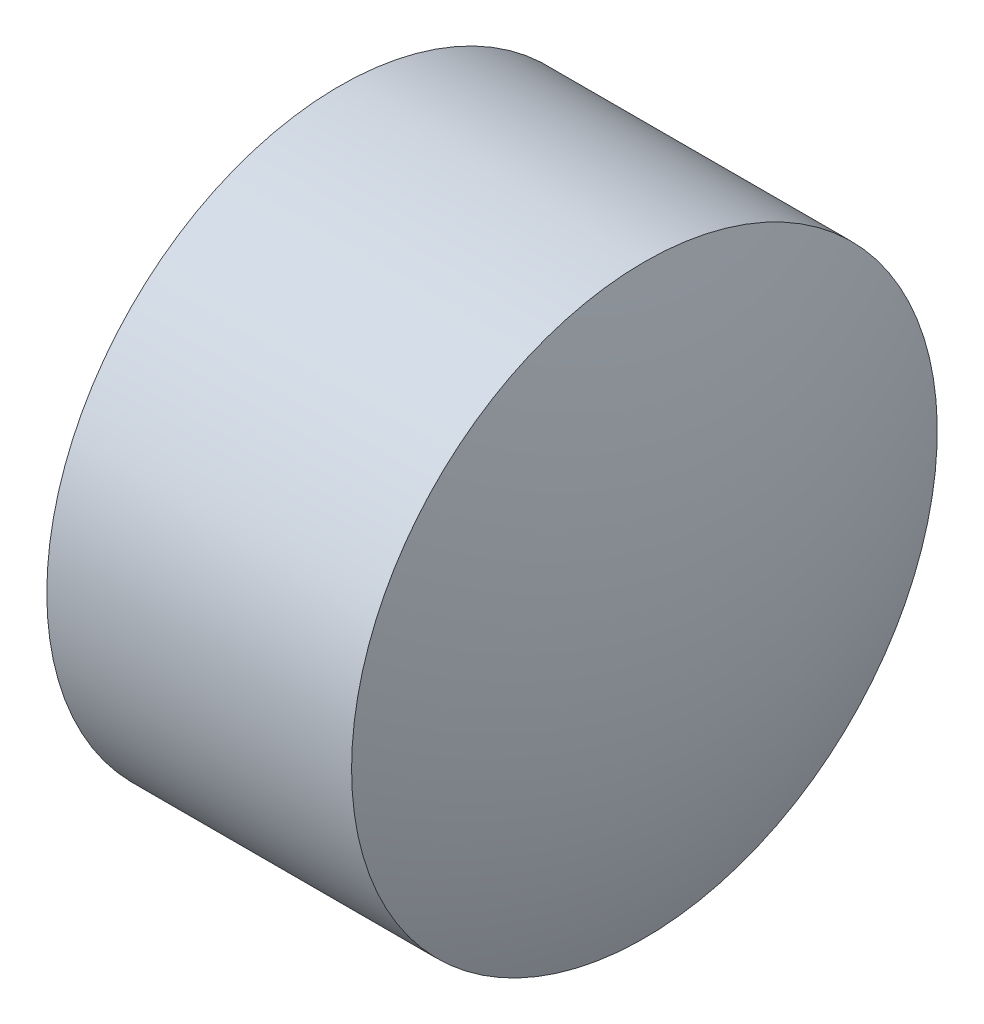
from build123d import *

# Parameters (mm, degrees)
HEXAGONSOCKET_DEPTH = 1.2


with BuildPart() as part:
    # BodySke → BaseBody (revolve)
    with BuildSketch(Plane.XY):
        with BuildLine():
            Line((0, 1.5), (0, 0))
            Line((0, 0), (2, 0))
            ThreePointArc((2, 0), (1.930171789, 0.76268014), (1.723009049, 1.5))
            Line((1.723009049, 1.5), (0, 1.5))
        make_face()
    revolve(axis=Axis((0, 0, 0), (1, 0, 0)))

    # HeadChamferSke → HeadChamfer (revolve, cut)
    with BuildSketch(Plane.XY):
        Polygon((0, 1.5), (0, 1.2195), (0.161946751, 1.5), align=None)
    revolve(axis=Axis((0, 0, 0), (1, 0, 0)), mode=Mode.SUBTRACT)

    # HexagonSocketSke → HexagonSocket (cut)
    with BuildSketch(Plane.ZY):
        Polygon((0, 0.866025404), (-0.75, 0.433012702), (-0.75, -0.433012702), (0, -0.866025404), (0.75, -0.433012702), (0.75, 0.433012702), align=None)
    extrude(amount=-HEXAGONSOCKET_DEPTH, mode=Mode.SUBTRACT)


solid = part.part
